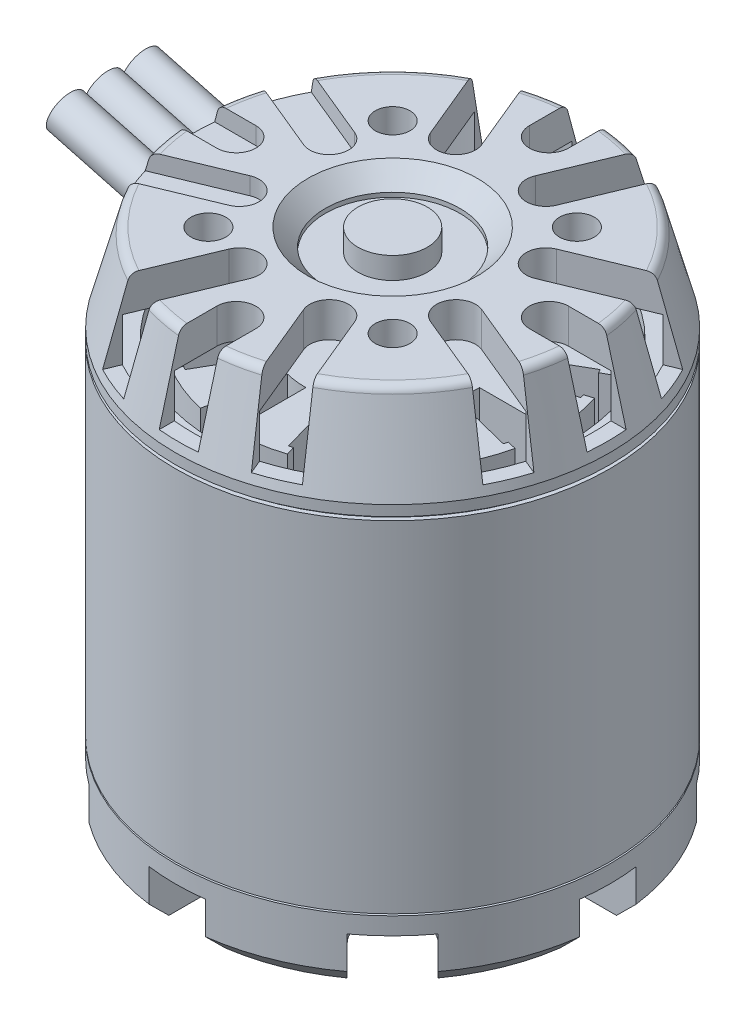
from build123d import *

# Parameters (mm, degrees)
SKETCH_1_R               = 25
EXTRUDE_1_DEPTH          = 40
EXTRUDE_START            = 7.4
SKETCH_2_R               = 25
EXTRUDE_2_DEPTH          = 7.4
SKETCH_3_R               = 2
CUT_EXTRUDE_1_DEPTH      = 6
CHAMFER_1_SIZE           = 2.25
SKETCH_4_R               = 6.6
EXTRUDE_3_DEPTH          = 1.5
SKETCH_5_R               = 4
CUT_EXTRUDE_2_DEPTH      = 0.1
SKETCH_6_R               = 24.5
EXTRUDE_4_DEPTH          = 0.4
SKETCH_7_R               = 25
EXTRUDE_5_DEPTH          = 11.2
SKETCH_8_R               = 1.5
CUT_EXTRUDE_3_DEPTH      = 4
CHAMFER_2_SIZE           = 10
CHAMFER_2_SIZE2          = 2.679491924
SKETCH_9_R               = 7.75
CUT_EXTRUDE_6_DEPTH      = 2.5
SKETCH_10_R              = 4
EXTRUDE_6_DEPTH          = 2.5
CHAMFER_4_SIZE           = 2
FILLET_1_R               = 1
CUT_EXTRUDE_START        = -4
SKETCH_11_R              = 20.55
CUT_EXTRUDE_8_DEPTH      = 4
CUT_EXTRUDE_9_DEPTH      = 6
CUT_EXTRUDE_10_DEPTH     = 6
PATTERN_CIRCULAR_1_COUNT = 4
SKETCH_15_R              = 20.55
SKETCH_15_R_2            = 18.55
CUT_EXTRUDE_17_DEPTH     = 40
CUT_EXTRUDE_18_DEPTH     = 40
PATTERN_CIRCULAR_2_COUNT = 12
SKETCH_17_R              = 23
CUT_EXTRUDE_19_DEPTH     = 7
CUT_EXTRUDE_20_DEPTH     = 9
PATTERN_CIRCULAR_3_COUNT = 2
CUT_EXTRUDE_21_DEPTH     = 9
CUT_EXTRUDE_22_DEPTH     = 2
CUT_EXTRUDE_23_DEPTH     = 37
SKETCH_22_R              = 4
EXTRUDE_7_DEPTH          = 60
SKETCH_23_R              = 25
SKETCH_23_R_2            = 24.5
CUT_EXTRUDE_24_DEPTH     = 0.2
SKETCH_24_R              = 2
CUT_EXTRUDE_25_DEPTH     = 4
PATTERN_CIRCULAR_4_COUNT = 4
SKETCH_25_R              = 2
SKETCH_25_R_2            = 1.5
EXTRUDE_8_DEPTH          = 4
PATTERN_CIRCULAR_5_COUNT = 4
SKETCH_26_R              = 7
EXTRUDE_9_DEPTH          = 1.5
EXTRUDE_10_DEPTH         = 10
EXTRUDE_10_DEPTH_BACK    = 10
SKETCH_27_R              = 2.162082192


with BuildPart() as part:
    # 草图1 → 凸台-拉伸1 (new body)
    with BuildSketch(Plane(origin=(0, 0, 0), x_dir=(1, 0, 0), z_dir=(0, 1, 0))):
        with Locations(Location((0, 0, 0), (0, 0, 270))):
            Circle(SKETCH_1_R)
    extrude(amount=EXTRUDE_1_DEPTH)

    # 草图2 → 凸台-拉伸2 (add)
    with BuildSketch(Plane.XZ.offset(EXTRUDE_START)):
        with Locations(Location((0, 0, 0), (0, 0, 270))):
            Circle(SKETCH_2_R)
    extrude(amount=-EXTRUDE_2_DEPTH)

    # 草图3 → 切除-拉伸1 (cut)
    with BuildSketch(Plane.XZ.offset(7.4)):
        with Locations(Location((7.071067812, 7.071067812, 0), (0, 0, 270))):
            Circle(SKETCH_3_R)
        with Locations(Location((7.071067812, -7.071067812, 0), (0, 0, 270))):
            Circle(SKETCH_3_R)
        with Locations(Location((-7.071067812, -7.071067812, 0), (0, 0, 270))):
            Circle(SKETCH_3_R)
        with Locations(Location((-7.071067812, 7.071067812, 0), (0, 0, 270))):
            Circle(SKETCH_3_R)
    extrude(amount=-CUT_EXTRUDE_1_DEPTH, mode=Mode.SUBTRACT)

    # 倒角1
    chamfer_1_edges = [part.edges().sort_by_distance(p)[0] for p in [
        (0, -7.4, 25),
    ]]
    chamfer(chamfer_1_edges, length=CHAMFER_1_SIZE)

    # 草图4 → 凸台-拉伸3 (add)
    with BuildSketch(Plane.XZ.offset(7.4)):
        with Locations(Location((0, 0, 0), (0, 0, 270))):
            Circle(SKETCH_4_R)
    extrude(amount=EXTRUDE_3_DEPTH)

    # 草图5 → 切除-拉伸2 (cut)
    with BuildSketch(Plane.XZ.offset(8.9)):
        with Locations(Location((0, 0, 0), (0, 0, 270))):
            Circle(SKETCH_5_R)
    extrude(amount=-CUT_EXTRUDE_2_DEPTH, mode=Mode.SUBTRACT)

    # 草图6 → 凸台-拉伸4 (add)
    with BuildSketch(Plane(origin=(0, 40, 0), x_dir=(1, 0, 0), z_dir=(0, 1, 0))):
        with Locations(Location((0, 0, 0), (0, 0, 270))):
            Circle(SKETCH_6_R)
    extrude(amount=EXTRUDE_4_DEPTH)

    # 草图7 → 凸台-拉伸5 (add)
    with BuildSketch(Plane(origin=(0, 40.4, 0), x_dir=(1, 0, 0), z_dir=(0, 1, 0))):
        with Locations(Location((0, 0, 0), (0, 0, 90))):
            Circle(SKETCH_7_R)
    extrude(amount=EXTRUDE_5_DEPTH)

    # 草图8 → 切除-拉伸3 (cut)
    with BuildSketch(Plane(origin=(0, 51.6, 0), x_dir=(1, 0, 0), z_dir=(0, 1, 0))):
        with Locations(Location((10.606601718, 10.606601718, 0), (0, 0, 270))):
            Circle(SKETCH_8_R)
        with Locations(Location((-10.606601718, 10.606601718, 0), (0, 0, 270))):
            Circle(SKETCH_8_R)
        with Locations(Location((10.606601718, -10.606601718, 0), (0, 0, 270))):
            Circle(SKETCH_8_R)
        with Locations(Location((-10.606601718, -10.606601718, 0), (0, 0, 270))):
            Circle(SKETCH_8_R)
    extrude(amount=-CUT_EXTRUDE_3_DEPTH, mode=Mode.SUBTRACT)

    # 倒角2
    chamfer_2_edges = [part.edges().sort_by_distance(p)[0] for p in [
        (0, 51.6, 25),
    ]]
    chamfer_2_side = [part.faces().sort_by_distance(p)[0] for p in [
        (0, 46, 25),
    ]]
    chamfer(chamfer_2_edges, length=CHAMFER_2_SIZE, length2=CHAMFER_2_SIZE2, reference=chamfer_2_side[0])

    # 草图9 → 切除-拉伸6 (cut)
    with BuildSketch(Plane(origin=(0, 51.6, 0), x_dir=(1, 0, 0), z_dir=(0, 1, 0))):
        with Locations(Location((0, 0, 0), (0, 0, 270))):
            Circle(SKETCH_9_R)
    extrude(amount=-CUT_EXTRUDE_6_DEPTH, mode=Mode.SUBTRACT)

    # 草图10 → 凸台-拉伸6 (add)
    with BuildSketch(Plane(origin=(0, 49.1, 0), x_dir=(1, 0, 0), z_dir=(0, 1, 0))):
        with Locations(Location((0, 0, 0), (0, 0, 90))):
            Circle(SKETCH_10_R)
    extrude(amount=EXTRUDE_6_DEPTH)

    # 倒角4
    chamfer_4_edges = [part.edges().sort_by_distance(p)[0] for p in [
        (0, 51.6, -7.75),
    ]]
    chamfer(chamfer_4_edges, length=CHAMFER_4_SIZE)

    # 圆角1
    fillet_1_edges = [part.edges().sort_by_distance(p)[0] for p in [
        (0, 51.6, 22.320508076),
    ]]
    fillet(fillet_1_edges, radius=FILLET_1_R)

    # 草图11 → 切除-拉伸8 (cut)
    with BuildSketch(Plane.XZ.offset(7.4).offset(CUT_EXTRUDE_START)):
        with Locations(Location((0, 0, 0), (0, 0, 270))):
            Circle(SKETCH_11_R)
    extrude(amount=-CUT_EXTRUDE_8_DEPTH, mode=Mode.SUBTRACT)

    # 草图12 → 切除-拉伸9 (cut)
    with BuildSketch(Plane.XZ.offset(7.4)):
        with BuildLine():
            Line((-12, 3.25), (-22.516660498, 3.25))
            ThreePointArc((-22.516660498, 3.25), (-22.75, 0), (-22.516660498, -3.25))
            Line((-22.516660498, -3.25), (-12, -3.25))
            ThreePointArc((-12, -3.25), (-8.75, 0), (-12, 3.25))
        make_face()
        with BuildLine():
            ThreePointArc((-22.516660498, -3.25), (-22.75, 0), (-22.516660498, 3.25))
            Line((-22.516660498, 3.25), (-24.787849846, 3.25))
            ThreePointArc((-24.787849846, 3.25), (-25, 0), (-24.787849846, -3.25))
            Line((-24.787849846, -3.25), (-22.516660498, -3.25))
        make_face()
        with BuildLine():
            ThreePointArc((-24.787849846, -3.25), (-25, 0), (-24.787849846, 3.25))
            Line((-24.787849846, 3.25), (-25, 3.25))
            ThreePointArc((-25, 3.25), (-28.25, 0), (-25, -3.25))
            Line((-25, -3.25), (-24.787849846, -3.25))
        make_face()
        with BuildLine():
            ThreePointArc((-3.25, 24.787849846), (0, 25), (3.25, 24.787849846))
            Line((3.25, 24.787849846), (3.25, 25))
            ThreePointArc((3.25, 25), (0, 28.25), (-3.25, 25))
            Line((-3.25, 25), (-3.25, 24.787849846))
        make_face()
        with BuildLine():
            ThreePointArc((-3.25, 22.516660498), (0, 22.75), (3.25, 22.516660498))
            Line((3.25, 22.516660498), (3.25, 24.787849846))
            ThreePointArc((3.25, 24.787849846), (0, 25), (-3.25, 24.787849846))
            Line((-3.25, 24.787849846), (-3.25, 22.516660498))
        make_face()
        with BuildLine():
            Line((3.25, 12), (3.25, 22.516660498))
            ThreePointArc((3.25, 22.516660498), (0, 22.75), (-3.25, 22.516660498))
            Line((-3.25, 22.516660498), (-3.25, 12))
            ThreePointArc((-3.25, 12), (0, 8.75), (3.25, 12))
        make_face()
        with BuildLine():
            Line((22.516660498, 3.25), (12, 3.25))
            ThreePointArc((12, 3.25), (8.75, 0), (12, -3.25))
            Line((12, -3.25), (22.516660498, -3.25))
            ThreePointArc((22.516660498, -3.25), (22.691590142, -1.629182872), (22.75, 0))
            ThreePointArc((22.75, 0), (22.691590142, 1.629182872), (22.516660498, 3.25))
        make_face()
        with BuildLine():
            Line((24.787849846, 3.25), (22.516660498, 3.25))
            ThreePointArc((22.516660498, 3.25), (22.691590142, 1.629182872), (22.75, 0))
            ThreePointArc((22.75, 0), (22.691590142, -1.629182872), (22.516660498, -3.25))
            Line((22.516660498, -3.25), (24.787849846, -3.25))
            ThreePointArc((24.787849846, -3.25), (24.946906082, -1.62845845), (25, 0))
            ThreePointArc((25, 0), (24.946906082, 1.62845845), (24.787849846, 3.25))
        make_face()
        with BuildLine():
            Line((25, 3.25), (24.787849846, 3.25))
            ThreePointArc((24.787849846, 3.25), (24.946906082, 1.62845845), (25, 0))
            ThreePointArc((25, 0), (24.946906082, -1.62845845), (24.787849846, -3.25))
            Line((24.787849846, -3.25), (25, -3.25))
            ThreePointArc((25, -3.25), (28.25, 0), (25, 3.25))
        make_face()
        with BuildLine():
            Line((3.25, -24.787849846), (3.25, -22.516660498))
            ThreePointArc((3.25, -22.516660498), (0, -22.75), (-3.25, -22.516660498))
            Line((-3.25, -22.516660498), (-3.25, -24.787849846))
            ThreePointArc((-3.25, -24.787849846), (0, -25), (3.25, -24.787849846))
        make_face()
        with BuildLine():
            ThreePointArc((-3.25, -22.516660498), (0, -22.75), (3.25, -22.516660498))
            Line((3.25, -22.516660498), (3.25, -12))
            ThreePointArc((3.25, -12), (0, -8.75), (-3.25, -12))
            Line((-3.25, -12), (-3.25, -22.516660498))
        make_face()
        with BuildLine():
            Line((3.25, -25), (3.25, -24.787849846))
            ThreePointArc((3.25, -24.787849846), (0, -25), (-3.25, -24.787849846))
            Line((-3.25, -24.787849846), (-3.25, -25))
            ThreePointArc((-3.25, -25), (0, -28.25), (3.25, -25))
        make_face()
    extrude(amount=-CUT_EXTRUDE_9_DEPTH, mode=Mode.SUBTRACT)

    # 草图13 → 切除-拉伸10 (cut)
    with BuildSketch(Plane.XZ.offset(7.4)):
        with BuildLine():
            Line((9.75807358, 14.990663761), (16.018491122, 21.251081302))
            ThreePointArc((16.018491122, 21.251081302), (21.251081302, 21.251081302), (21.251081302, 16.018491122))
            Line((21.251081302, 16.018491122), (14.990663761, 9.75807358))
            ThreePointArc((14.990663761, 9.75807358), (9.75807358, 9.75807358), (9.75807358, 14.990663761))
        make_face()
    cut_extrude_10 = extrude(amount=-CUT_EXTRUDE_10_DEPTH, mode=Mode.SUBTRACT)

    # 阵列(圆周)1: 切除-拉伸10 ×4 about axis
    pattern_circular_1_axis = Axis((0, 0, 0), (0, 1, 0))
    for i in range(1, PATTERN_CIRCULAR_1_COUNT):
        add(cut_extrude_10.rotate(pattern_circular_1_axis, i * 360 / PATTERN_CIRCULAR_1_COUNT), mode=Mode.SUBTRACT)

    # 草图15 → 切除-拉伸17 (cut)
    with BuildSketch(Plane.XZ.offset(-0.6)):
        with Locations(Location((0, 0, 0), (0, 0, 270))):
            Circle(SKETCH_15_R)
        with Locations(Location((0, 0, 0), (0, 0, 270))):
            Circle(SKETCH_15_R_2, mode=Mode.SUBTRACT)
    extrude(amount=-CUT_EXTRUDE_17_DEPTH, mode=Mode.SUBTRACT)

    # 草图16 → 切除-拉伸18 (cut)
    with BuildSketch(Plane.XZ.offset(-0.6)):
        with BuildLine():
            Line((-10, 0), (-17.5, 0))
            ThreePointArc((-17.5, 0), (-17.498500733, -0.229067922), (-17.494003187, -0.458096595))
            Line((-17.494003187, -0.458096595), (-18.543643378, -0.485582391))
            ThreePointArc((-18.543643378, -0.485582391), (-18.411731113, -2.26067632), (-18.110290932, -4.014954839))
            Line((-18.110290932, -4.014954839), (-17.085180125, -3.787693244))
            ThreePointArc((-17.085180125, -3.787693244), (-17.034137023, -4.011006841), (-16.98017521, -4.233633173))
            Line((-16.98017521, -4.233633173), (-9.702957263, -2.419218956))
            ThreePointArc((-9.702957263, -2.419218956), (-9.925461516, -1.218693434), (-10, 0))
        make_face()
    cut_extrude_18 = extrude(amount=-CUT_EXTRUDE_18_DEPTH, mode=Mode.SUBTRACT)

    # 阵列(圆周)2: 切除-拉伸18 ×12 about axis
    pattern_circular_2_axis = Axis((0, 0, 0), (0, 1, 0))
    for i in range(1, PATTERN_CIRCULAR_2_COUNT):
        add(cut_extrude_18.rotate(pattern_circular_2_axis, i * 360 / PATTERN_CIRCULAR_2_COUNT), mode=Mode.SUBTRACT)

    # 草图17 → 切除-拉伸19 (cut)
    with BuildSketch(Plane(origin=(0, 51.6, 0), x_dir=(1, 0, 0), z_dir=(0, 1, 0)).offset(CUT_EXTRUDE_START)):
        with Locations(Location((0, 0, 0), (0, 0, 270))):
            Circle(SKETCH_17_R)
    extrude(amount=-CUT_EXTRUDE_19_DEPTH, mode=Mode.SUBTRACT)


with BuildPart() as cut_extrude_19_piece_1:
    # of the separate pieces the step leaves, piece 1, a body of its own (cut_extrude_19_pieces)
    add(part.part.solids().sort_by_distance((0, 51.6, -21.553181088))[0])

    # 草图18 → 切除-拉伸20 (cut)
    with BuildSketch(Plane(origin=(0, 51.6, 0), x_dir=(1, 0, 0), z_dir=(0, 1, 0))):
        with BuildLine():
            Line((2.25, -18), (2.25, -25))
            ThreePointArc((2.25, -25), (0, -27.25), (-2.25, -25))
            Line((-2.25, -25), (-2.25, -18))
            ThreePointArc((-2.25, -18), (0, -15.75), (2.25, -18))
        make_face()
        with BuildLine():
            Line((-3.087497389, -13.333411412), (-7.488356861, -23.958026036))
            ThreePointArc((-7.488356861, -23.958026036), (-10.428123532, -25.175717261), (-11.645814757, -22.23595059))
            Line((-11.645814757, -22.23595059), (-7.244955285, -11.611335966))
            ThreePointArc((-7.244955285, -11.611335966), (-4.305188614, -10.393644741), (-3.087497389, -13.333411412))
        make_face()
        with BuildLine():
            Line((7.244955285, -11.611335966), (11.645814757, -22.23595059))
            ThreePointArc((11.645814757, -22.23595059), (10.428123532, -25.175717261), (7.488356861, -23.958026036))
            Line((7.488356861, -23.958026036), (3.087497389, -13.333411412))
            ThreePointArc((3.087497389, -13.333411412), (4.305188614, -10.393644741), (7.244955285, -11.611335966))
        make_face()
    cut_extrude_20 = extrude(amount=-CUT_EXTRUDE_20_DEPTH, mode=Mode.SUBTRACT)

    # 阵列(圆周)3: 切除-拉伸20 ×2 about axis
    pattern_circular_3_axis = Axis((0, 0, 0), (0, 1, 0))
    for i in range(1, PATTERN_CIRCULAR_3_COUNT):
        add(cut_extrude_20.rotate(pattern_circular_3_axis, i * 360 / PATTERN_CIRCULAR_3_COUNT), mode=Mode.SUBTRACT)

    # 草图19 → 切除-拉伸21 (cut)
    with BuildSketch(Plane(origin=(0, 51.6, 0), x_dir=(1, 0, 0), z_dir=(0, 1, 0))):
        with BuildLine():
            Line((25.175717261, 10.428123532), (19.912542867, 8.248045317))
            ThreePointArc((19.912542867, 8.248045317), (20.316432521, 7.195983922), (20.664781041, 6.12425012))
            Line((20.664781041, 6.12425012), (23.958026036, 7.488356861))
            ThreePointArc((23.958026036, 7.488356861), (25.175717261, 8.706048086), (25.175717261, 10.428123532))
        make_face()
        with BuildLine():
            ThreePointArc((11.611335966, 7.244955285), (10.393644741, 6.02726406), (10.393644741, 4.305188614))
            Line((10.393644741, 4.305188614), (19.912542867, 8.248045317))
            ThreePointArc((19.912542867, 8.248045317), (19.454216234, 9.277558177), (18.942705595, 10.281708016))
            Line((18.942705595, 10.281708016), (11.611335966, 7.244955285))
        make_face()
        with BuildLine():
            ThreePointArc((18.942705595, 10.281708016), (19.454216234, 9.277558177), (19.912542867, 8.248045317))
            Line((19.912542867, 8.248045317), (25.175717261, 10.428123532))
            ThreePointArc((25.175717261, 10.428123532), (23.958026036, 11.645814757), (22.23595059, 11.645814757))
            Line((22.23595059, 11.645814757), (18.942705595, 10.281708016))
        make_face()
        with BuildLine():
            ThreePointArc((21.435417304, -2.25), (21.553181088, 0), (21.435417304, 2.25))
            Line((21.435417304, 2.25), (18, 2.25))
            ThreePointArc((18, 2.25), (15.75, 0), (18, -2.25))
            Line((18, -2.25), (21.435417304, -2.25))
        make_face()
        with BuildLine():
            Line((26, 2.25), (21.435417304, 2.25))
            ThreePointArc((21.435417304, 2.25), (21.553181088, 0), (21.435417304, -2.25))
            Line((21.435417304, -2.25), (26, -2.25))
            ThreePointArc((26, -2.25), (28.25, 0), (26, 2.25))
        make_face()
        with BuildLine():
            ThreePointArc((20.664781041, -6.12425012), (20.316432521, -7.195983922), (19.912542867, -8.248045317))
            Line((19.912542867, -8.248045317), (25.175717261, -10.428123532))
            ThreePointArc((25.175717261, -10.428123532), (25.175717261, -8.706048086), (23.958026036, -7.488356861))
            Line((23.958026036, -7.488356861), (20.664781041, -6.12425012))
        make_face()
        with BuildLine():
            ThreePointArc((13.333411412, -3.087497389), (11.611335966, -3.087497389), (10.393644741, -4.305188614))
            Line((10.393644741, -4.305188614), (19.912542867, -8.248045317))
            ThreePointArc((19.912542867, -8.248045317), (20.316432521, -7.195983922), (20.664781041, -6.12425012))
            Line((20.664781041, -6.12425012), (13.333411412, -3.087497389))
        make_face()
        with BuildLine():
            Line((19.912542867, -8.248045317), (10.393644741, -4.305188614))
            ThreePointArc((10.393644741, -4.305188614), (10.393644741, -6.02726406), (11.611335966, -7.244955285))
            Line((11.611335966, -7.244955285), (18.942705595, -10.281708016))
            ThreePointArc((18.942705595, -10.281708016), (19.454216234, -9.277558177), (19.912542867, -8.248045317))
        make_face()
        with BuildLine():
            Line((25.175717261, -10.428123532), (19.912542867, -8.248045317))
            ThreePointArc((19.912542867, -8.248045317), (19.454216234, -9.277558177), (18.942705595, -10.281708016))
            Line((18.942705595, -10.281708016), (22.23595059, -11.645814757))
            ThreePointArc((22.23595059, -11.645814757), (23.958026036, -11.645814757), (25.175717261, -10.428123532))
        make_face()
        with BuildLine():
            Line((19.912542867, 8.248045317), (10.393644741, 4.305188614))
            ThreePointArc((10.393644741, 4.305188614), (11.611335966, 3.087497389), (13.333411412, 3.087497389))
            Line((13.333411412, 3.087497389), (20.664781041, 6.12425012))
            ThreePointArc((20.664781041, 6.12425012), (20.316432521, 7.195983922), (19.912542867, 8.248045317))
        make_face()
    extrude(amount=-CUT_EXTRUDE_21_DEPTH, mode=Mode.SUBTRACT)

    # 草图20 → 切除-拉伸22 (cut)
    with BuildSketch(Plane(origin=(0, 51.6, 0), x_dir=(1, 0, 0), z_dir=(0, 1, 0))):
        with BuildLine():
            Line((-18, -2.25), (-28.449166939, -2.25))
            ThreePointArc((-28.449166939, -2.25), (-30.699166939, 0), (-28.449166939, 2.25))
            Line((-28.449166939, 2.25), (-18, 2.25))
            ThreePointArc((-18, 2.25), (-15.75, 0), (-18, -2.25))
        make_face()
        with BuildLine():
            Line((-22.23595059, 11.645814757), (-11.611335966, 7.244955285))
            ThreePointArc((-11.611335966, 7.244955285), (-10.393644741, 4.305188614), (-13.333411412, 3.087497389))
            Line((-13.333411412, 3.087497389), (-23.958026036, 7.488356861))
            ThreePointArc((-23.958026036, 7.488356861), (-25.175717261, 10.428123532), (-22.23595059, 11.645814757))
        make_face()
        with BuildLine():
            Line((-22.23595059, -11.645814757), (-11.611335966, -7.244955285))
            ThreePointArc((-11.611335966, -7.244955285), (-10.393644741, -4.305188614), (-13.333411412, -3.087497389))
            Line((-13.333411412, -3.087497389), (-23.958026036, -7.488356861))
            ThreePointArc((-23.958026036, -7.488356861), (-25.175717261, -10.428123532), (-22.23595059, -11.645814757))
        make_face()
    extrude(amount=-CUT_EXTRUDE_22_DEPTH, mode=Mode.SUBTRACT)

    # 草图21 → 切除-拉伸23 (cut)
    with BuildSketch(Plane(origin=(0, 0, 0), x_dir=(0, 0, -1), z_dir=(1, 0, 0))):
        with BuildLine():
            Line((3.911688298, 43.151516079), (-3.588311702, 43.151516079))
            ThreePointArc((-3.588311702, 43.151516079), (-6.338311702, 45.901516079), (-3.588311702, 48.651516079))
            Line((-3.588311702, 48.651516079), (3.911688298, 48.651516079))
            ThreePointArc((3.911688298, 48.651516079), (6.661688298, 45.901516079), (3.911688298, 43.151516079))
        make_face()
    extrude(amount=-CUT_EXTRUDE_23_DEPTH, mode=Mode.SUBTRACT)



with BuildPart() as cut_extrude_19_piece_2:
    # of the separate pieces the step leaves, piece 2, a body of its own (cut_extrude_19_pieces)
    add(part.part.solids().sort_by_distance((0.485582391, 0.6, -18.543643378))[0])


with BuildPart() as cut_extrude_19_piece_1_1:
    add(cut_extrude_19_piece_1.part)

    add(cut_extrude_19_piece_2.part)  # 凸台-拉伸7 merges 切除-拉伸19 piece 2
    # 草图22 → 凸台-拉伸7 (add)
    with BuildSketch(Plane(origin=(0, 51.6, 0), x_dir=(1, 0, 0), z_dir=(0, 1, 0))):
        with Locations(Location((0, 0, 0), (0, 0, 270))):
            Circle(SKETCH_22_R)
    extrude(amount=-EXTRUDE_7_DEPTH)

    # 草图23 → 切除-拉伸24 (cut)
    with BuildSketch(Plane(origin=(0, 0.6, 0), x_dir=(-1, 0, 0), z_dir=(0, -1, 0))):
        with Locations(Location((0, 0, 0), (0, 0, 90))):
            Circle(SKETCH_23_R)
        with Locations(Location((0, 0, 0), (0, 0, 270))):
            Circle(SKETCH_23_R_2, mode=Mode.SUBTRACT)
    extrude(amount=-CUT_EXTRUDE_24_DEPTH, mode=Mode.SUBTRACT)

    # 草图24 → 切除-拉伸25 (cut)
    with BuildSketch(Plane(origin=(0, 51.6, 0), x_dir=(1, 0, 0), z_dir=(0, 1, 0))):
        with Locations(Location((-10.606601718, 10.606601718, 0), (0, 0, 270))):
            Circle(SKETCH_24_R)
    cut_extrude_25 = extrude(amount=-CUT_EXTRUDE_25_DEPTH, mode=Mode.SUBTRACT)

    # 阵列(圆周)4: 切除-拉伸25 ×4 about axis
    pattern_circular_4_axis = Axis((0, 0, 0), (0, 1, 0))
    for i in range(1, PATTERN_CIRCULAR_4_COUNT):
        add(cut_extrude_25.rotate(pattern_circular_4_axis, i * 360 / PATTERN_CIRCULAR_4_COUNT), mode=Mode.SUBTRACT)

    # 草图25 → 凸台-拉伸8 (add)
    with BuildSketch(Plane.XZ.offset(7.4)):
        with Locations((-7.071067812, 7.071067812)):
            Circle(SKETCH_25_R)
        with Locations(Location((-7.071067812, 7.071067812, 0), (0, 0, 270))):
            Circle(SKETCH_25_R_2, mode=Mode.SUBTRACT)
    extrude_8 = extrude(amount=-EXTRUDE_8_DEPTH)

    # 阵列(圆周)5: 凸台-拉伸8 ×4 about axis
    pattern_circular_5_axis = Axis((0, 0, 0), (0, 1, 0))
    for i in range(1, PATTERN_CIRCULAR_5_COUNT):
        add(extrude_8.rotate(pattern_circular_5_axis, i * 360 / PATTERN_CIRCULAR_5_COUNT))

    # 草图26 → 凸台-拉伸9 (add)
    with BuildSketch(Plane.XZ.offset(8.9)):
        with Locations(Location((0, 0, 0), (0, 0, 270))):
            Circle(SKETCH_26_R)
    extrude(amount=-EXTRUDE_9_DEPTH)

    # 草图27 → 凸台-拉伸10 (add, two sides: drawn at the far end of the back side and taken through both)
    with BuildSketch(Plane(origin=(-33.725317547, 9.036671601, 0), x_dir=(0, 0, 1), z_dir=(-0.9659258262890691, 0.25881904510251813, 0)).offset(-EXTRUDE_10_DEPTH_BACK)):
        with Locations(Location((4.164388937, 38.248977738, 0), (0, 0, 270))):
            Circle(SKETCH_27_R)
        with Locations(Location((-0.159775447, 38.248977738, 0), (0, 0, 270))):
            Circle(SKETCH_27_R)
        with Locations(Location((-4.483939831, 38.248977738, 0), (0, 0, 270))):
            Circle(SKETCH_27_R)
    extrude(amount=EXTRUDE_10_DEPTH + EXTRUDE_10_DEPTH_BACK)


solid = cut_extrude_19_piece_1_1.part
